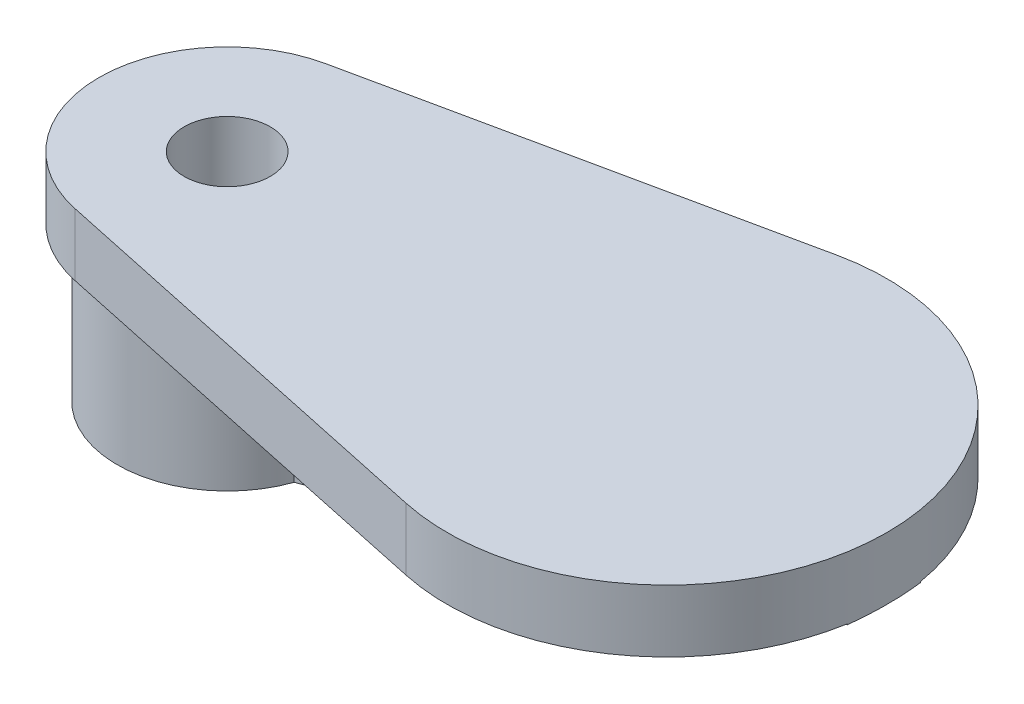
from build123d import *

# Parameters (mm, degrees)
SKETCH1_R               = 3
SKETCH1_R_2             = 1.175
BOSS_EXTRUDE1_DEPTH     = 5.9
BOSS_EXTRUDE2_START     = -1.7
SKETCH3_R               = 1.175
BOSS_EXTRUDE2_DEPTH     = 1.7
BOSS_EXTRUDE3_START     = 4.2
BOSS_EXTRUDE3_DEPTH     = 4.2
CUT_EXTRUDE1_DEPTH      = 20.869826371
CUT_EXTRUDE1_DEPTH_BACK = 20.869826371
CHAMFER2_SIZE           = 0.5


with BuildPart() as part:
    # Sketch1 → Boss-Extrude1 (new body)
    with BuildSketch(Plane(origin=(0, 0, 0), x_dir=(1, 0, 0), z_dir=(0, 1, 0))):
        with Locations(Location((0, 0, 0), (0, 0, 270))):
            Circle(SKETCH1_R)
        with Locations(Location((0, 0, 0), (0, 0, 270))):
            Circle(SKETCH1_R_2, mode=Mode.SUBTRACT)
    extrude(amount=BOSS_EXTRUDE1_DEPTH)

    # Sketch3 → Boss-Extrude2 (add)
    with BuildSketch(Plane(origin=(0, 5.9, 0), x_dir=(1, 0, 0), z_dir=(0, 1, 0)).offset(BOSS_EXTRUDE2_START)):
        with BuildLine():
            Line((-0.729166667, 3.42320259), (10.75, 5.868347297))
            ThreePointArc((10.75, 5.868347297), (18, 0), (10.75, -5.868347297))
            Line((10.75, -5.868347297), (-0.729166667, -3.42320259))
            ThreePointArc((-0.729166667, -3.42320259), (-3.5, 0), (-0.729166667, 3.42320259))
        make_face()
        with Locations(Location((0, 0, 0), (0, 0, 270))):
            Circle(SKETCH3_R, mode=Mode.SUBTRACT)
    extrude(amount=BOSS_EXTRUDE2_DEPTH)

    # Sketch4 → Boss-Extrude3 (add)
    with BuildSketch(Plane.XZ.offset(-4.2).offset(BOSS_EXTRUDE3_START)):
        with BuildLine():
            Line((2.828427125, 1), (17.916079783, 1))
            ThreePointArc((17.916079783, 1), (18, 0), (17.916079783, -1))
            Line((17.916079783, -1), (2.828427125, -1))
            ThreePointArc((2.828427125, -1), (3, 0), (2.828427125, 1))
        make_face()
    extrude(amount=-BOSS_EXTRUDE3_DEPTH)

    # Sketch5 → Cut-Extrude1 (cut, two sides: drawn at the far end of the back side and taken through both)
    with BuildSketch(Plane.XY.offset(-CUT_EXTRUDE1_DEPTH_BACK)):
        Polygon((2.828427125, 0), (18, 4.2), (18, 0), align=None)
    extrude(amount=CUT_EXTRUDE1_DEPTH + CUT_EXTRUDE1_DEPTH_BACK, mode=Mode.SUBTRACT)

    # Chamfer2
    chamfer2_edges = [part.edges().sort_by_distance(p)[0] for p in [
        (-3, 4.2, 0),
    ]]
    chamfer(chamfer2_edges, length=CHAMFER2_SIZE - 0.0001)  # a hair under: the kernel refuses the full size


solid = part.part
